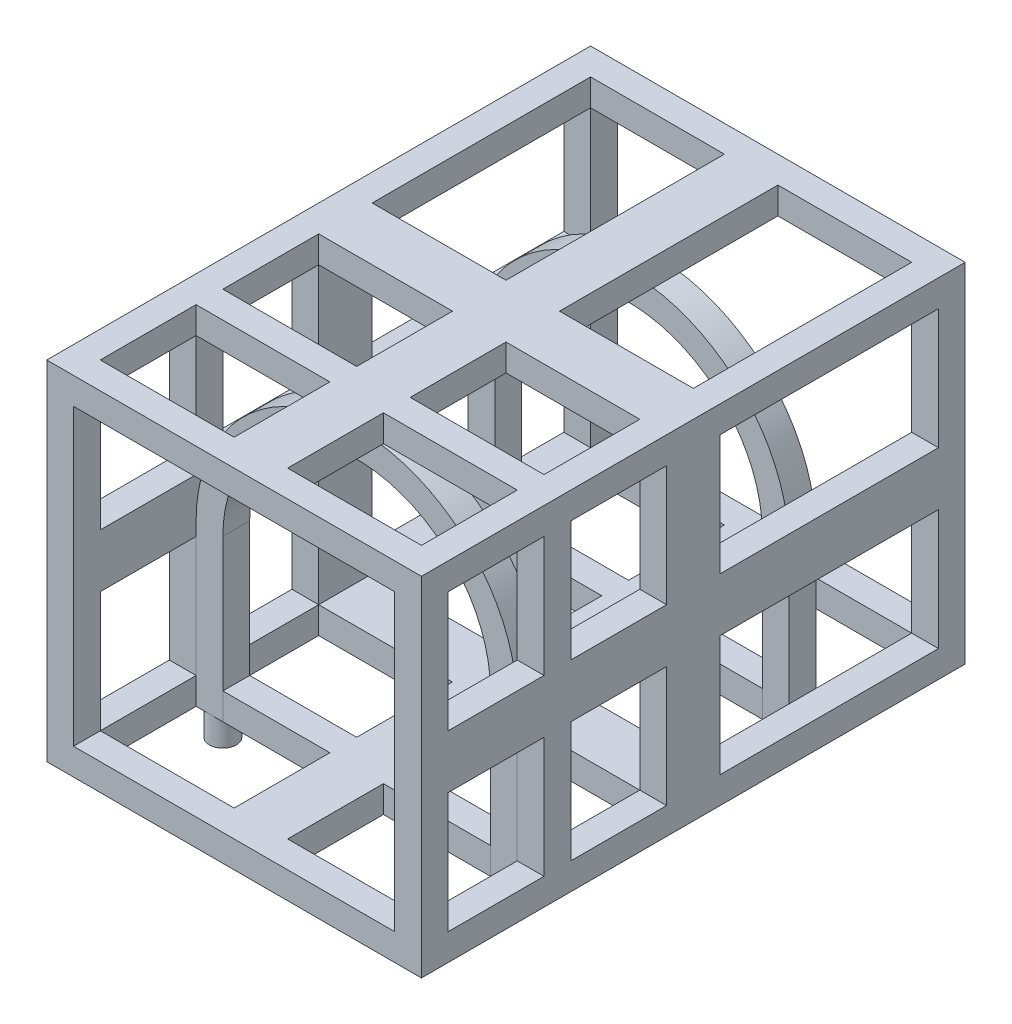
from build123d import *

# Parameters (mm, degrees)
CHASSIS_FRAME_SKETCH_W  = 140
CHASSIS_FRAME_SKETCH_H  = 130
CHASSIS_FRAME_DEPTH     = 101.6
U_BOLT_1_DEPTH          = 5
SKETCH20_R              = 5
U_BOLTS_BOLTS_1_DEPTH   = 10
U_BOLTS_BOLTS_1_2_DEPTH = 10
CUT_EXTRUDE2_DEPTH      = 187.608038412
CUT_EXTRUDE2_DEPTH_BACK = 187.608038412
SKETCH21_W              = 50
SKETCH21_H              = 81.6
CUT_EXTRUDE3_DEPTH      = 187.608038412
CUT_EXTRUDE3_DEPTH_BACK = 187.608038412
SKETCH22_W              = 81.6
SKETCH22_H              = 45
SKETCH23_W              = 50
SKETCH23_H              = 10
BOSS_EXTRUDE10_DEPTH    = 10
BOSS_EXTRUDE11_DEPTH    = 10
SKETCH25_W              = 140
SKETCH25_H              = 130
SKETCH25_W_2            = 120
SKETCH25_H_2            = 110
BOSS_EXTRUDE12_DEPTH    = 5


with BuildPart() as part:
    # Chassis Frame Sketch → Chassis Frame (new, symmetric)
    with BuildSketch(Plane.XY):
        with Locations((0, 5)):
            Rectangle(CHASSIS_FRAME_SKETCH_W, CHASSIS_FRAME_SKETCH_H)
        Polygon((-60, -50), (-60, 60), (60, 60), (60, -50), (50, -50), (-5.1e-08, -50), (-50, -50), align=None, mode=Mode.SUBTRACT)
    extrude(amount=CHASSIS_FRAME_DEPTH, both=True)

    # Sketch21 → Cut-Extrude2 (cut, two sides: drawn at the far end of the back side and taken through both)
    with BuildSketch(Plane(origin=(0, 70, 0), x_dir=(1, 0, 0), z_dir=(0, 1, 0)).offset(-CUT_EXTRUDE2_DEPTH_BACK)):
        with Locations((-35, 50.8)):
            Rectangle(SKETCH21_W, SKETCH21_H)
        with Locations((35, 50.8)):
            Rectangle(SKETCH21_W, SKETCH21_H)
        with Locations((-35, -50.8)):
            Rectangle(SKETCH21_W, SKETCH21_H)
        with Locations((35, -50.8)):
            Rectangle(SKETCH21_W, SKETCH21_H)
    extrude(amount=CUT_EXTRUDE2_DEPTH + CUT_EXTRUDE2_DEPTH_BACK, mode=Mode.SUBTRACT)

    # Sketch22 → Cut-Extrude3 (cut, two sides: drawn at the far end of the back side and taken through both)
    with BuildSketch(Plane(origin=(70, 0, 0), x_dir=(0, 0, -1), z_dir=(1, 0, 0)).offset(-CUT_EXTRUDE3_DEPTH_BACK)):
        with Locations((-50.8, 37.5)):
            Rectangle(SKETCH22_W, SKETCH22_H)
        with Locations((50.8, 37.5)):
            Rectangle(SKETCH22_W, SKETCH22_H)
        with Locations((-50.8, -27.5)):
            Rectangle(SKETCH22_W, SKETCH22_H)
        with Locations((50.8, -27.5)):
            Rectangle(SKETCH22_W, SKETCH22_H)
    extrude(amount=CUT_EXTRUDE3_DEPTH + CUT_EXTRUDE3_DEPTH_BACK, mode=Mode.SUBTRACT)

    # Sketch23 → Boss-Extrude10 (add)
    with BuildSketch(Plane(origin=(0, -60, 0), x_dir=(1, 0, 0), z_dir=(0, 1, 0))):
        with Locations((-35, -50.8)):
            Rectangle(SKETCH23_W, SKETCH23_H)
        with Locations((35, -50.8)):
            Rectangle(SKETCH23_W, SKETCH23_H)
    extrude(amount=BOSS_EXTRUDE10_DEPTH)

    # Sketch24 → Boss-Extrude11 (add)
    with BuildSketch(Plane(origin=(0, -60, 0), x_dir=(1, 0, 0), z_dir=(0, 1, 0))):
        Polygon((-60, 55.8), (-60, 45.8), (60, 45.8), (60, 55.8), (10, 55.8), (-10, 55.8), align=None)
    extrude(amount=BOSS_EXTRUDE11_DEPTH)

    # Sketch25 → Boss-Extrude12 (add, symmetric)
    with BuildSketch(Plane.XY.offset(50.8)):
        with Locations((0, 5)):
            Rectangle(SKETCH25_W, SKETCH25_H)
        with Locations((0, 5)):
            Rectangle(SKETCH25_W_2, SKETCH25_H_2, mode=Mode.SUBTRACT)
    extrude(amount=BOSS_EXTRUDE12_DEPTH, both=True)


with BuildPart() as body_2:
    # U Bolt Sketch → U Bolt 1 (new, symmetric)
    with BuildSketch(Plane.XY.offset(50.8)):
        with BuildLine():
            ThreePointArc((-50, 0), (0, 50), (50, 0))
            Line((50, 0), (50, -60))
            Line((50, -60), (60, -60))
            Line((60, -60), (60, 0))
            ThreePointArc((60, 0), (0, 60), (-60, 0))
            Line((-60, 0), (-60, -60))
            Line((-60, -60), (-50, -60))
            Line((-50, -60), (-50, 0))
        make_face()
    extrude(amount=U_BOLT_1_DEPTH, both=True)


with BuildPart() as body_3:
    # U Bolt 2: mirrored copy
    add(body_2.part.mirror(Plane.XY))


with BuildPart() as body_4:
    # Sketch20 → U Bolts Bolts 1 (new body)
    with BuildSketch(Plane(origin=(0, -70, 0), x_dir=(-1, 0, 0), z_dir=(0, -1, 0))):
        with Locations((55, -50.8)):
            Circle(SKETCH20_R)
    extrude(amount=-U_BOLTS_BOLTS_1_DEPTH)


with BuildPart() as body_5:
    # Sketch20 → U Bolts Bolts 1 2 (new body)
    with BuildSketch(Plane(origin=(0, -70, 0), x_dir=(-1, 0, 0), z_dir=(0, -1, 0))):
        with Locations((-55, -50.8)):
            Circle(SKETCH20_R)
    extrude(amount=-U_BOLTS_BOLTS_1_2_DEPTH)


with BuildPart() as body_6:
    # U Bolts Bolts 2: mirrored copy
    add(body_4.part.mirror(Plane.XY))


with BuildPart() as body_7:
    # U Bolts Bolts 2 2: mirrored copy
    add(body_5.part.mirror(Plane.XY))


solid = Compound([part.part, body_2.part, body_3.part, body_4.part, body_5.part, body_6.part, body_7.part])
